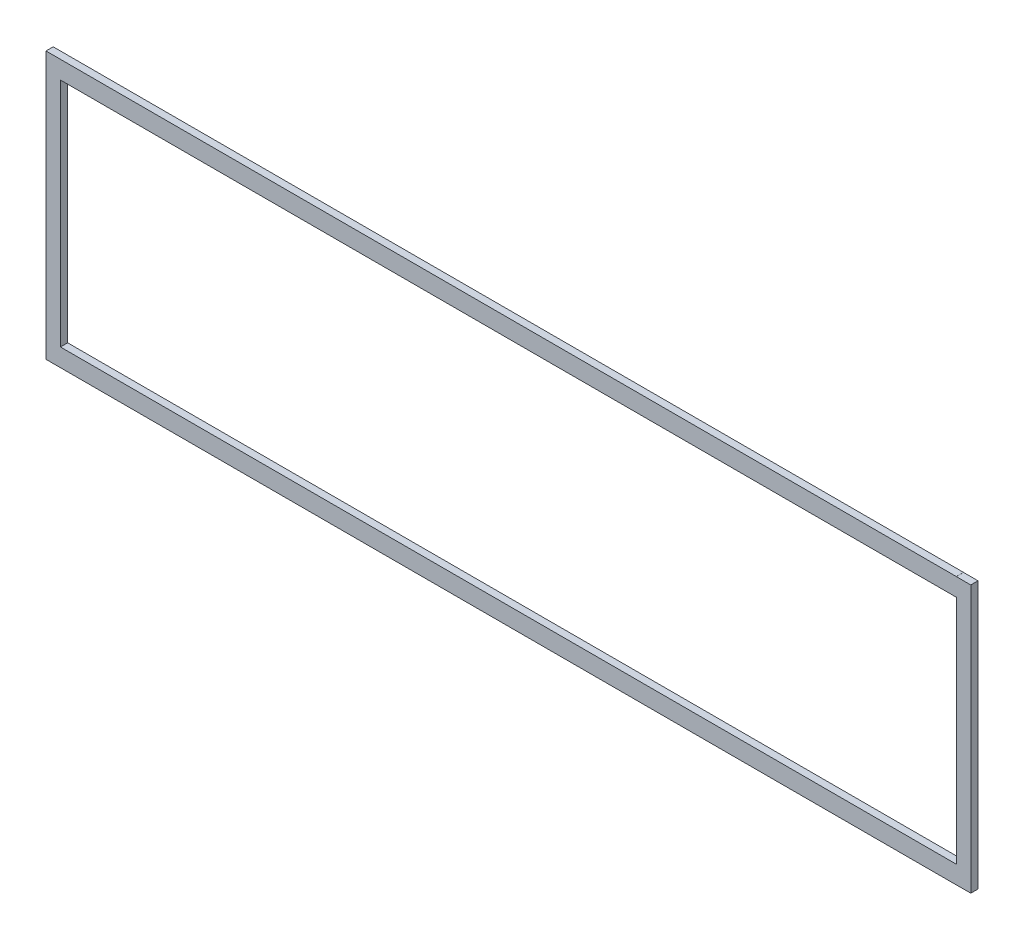
from build123d import *

# Parameters (mm, degrees)
SKETCH1_W           = 393.7
SKETCH1_H           = 101.6
BOSS_EXTRUDE1_DEPTH = 3.175


with BuildPart() as part:
    # Sketch1 → Boss-Extrude1 (new body)
    with BuildSketch(Plane.XY):
        Polygon((0, 117.36705), (0, 0), (400.05, 0), (400.05, 0.0254), (406.4, 0.0254), (406.4, 117.34165), (400.05, 117.34165), (400.05, 117.36705), align=None)
        with Locations((203.2, 58.683525)):
            Rectangle(SKETCH1_W, SKETCH1_H, mode=Mode.SUBTRACT)
    extrude(amount=BOSS_EXTRUDE1_DEPTH)


solid = part.part
